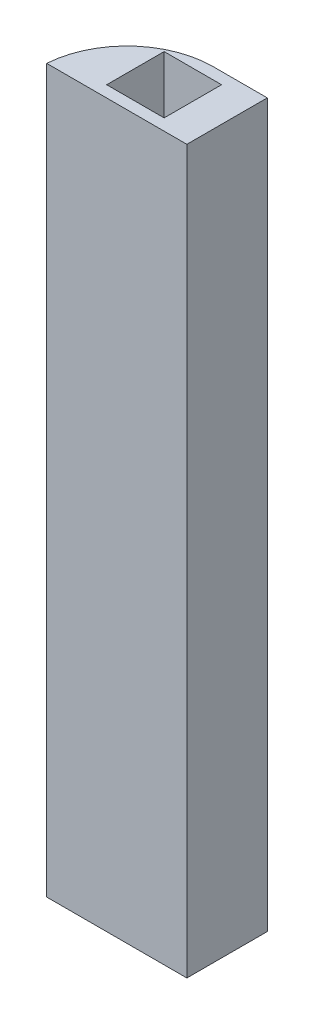
from build123d import *

# Parameters (mm, degrees)
SKETCH_1_W          = 24.4
SKETCH_1_H          = 14
EXTRUDE_1_DEPTH     = 125.7
CUT_EXTRUDE_1_DEPTH = 125.7
FILLET_1_R          = 15


with BuildPart() as part:
    # Эскиз1 → Бобышка-Вытянуть1 (new body)
    with BuildSketch(Plane(origin=(0, 0, 0), x_dir=(1, 0, 0), z_dir=(0, 1, 0))):
        Rectangle(SKETCH_1_W, SKETCH_1_H)
    extrude(amount=EXTRUDE_1_DEPTH)

    # Эскиз5 → Вырез-Вытянуть1 (cut)
    with BuildSketch(Plane(origin=(0, 0, 0), x_dir=(-1, 0, 0), z_dir=(0, -1, 0))):
        Polygon((-1.24, 0), (-1.24, -5), (3.76, -5), (3.76, 5), (-1.234412321, 5), (0, 0), align=None)
        Polygon((-6.24, -5), (-1.24, -5), (-1.24, 0), (-1.24, 5), (-6.24, 5), align=None)
        Polygon((-1.24, 5), (-1.24, 0), (0, 0), (-1.234412321, 5), align=None)
    extrude(amount=-CUT_EXTRUDE_1_DEPTH, mode=Mode.SUBTRACT)

    # Скругление1
    # the kernel refuses this fillet: 15 mm, written as the material it takes off along each edge
    with BuildSketch(Plane(origin=(-12.2, -37.416573868, -7), x_dir=(1, 0, 0), z_dir=(0, 1, 0))) as fillet_1_piece_1:
        with BuildLine():
            CenterArc((14.966629547, -15), FILLET_1_R, 90, 86.177446271)
            Line((0, -14), (-0.299332591, -13.98))
            ThreePointArc((-0.299332591, -13.98), (-0.3, -7), (-0.3, 0))
            Line((-0.3, 0), (0, 0.3))
            Line((0, 0.3), (14.966629547, 0.3))
            Line((14.966629547, 0.3), (14.966629547, 0))
        make_face()
    extrude(amount=200.533147735, mode=Mode.SUBTRACT)


solid = part.part
